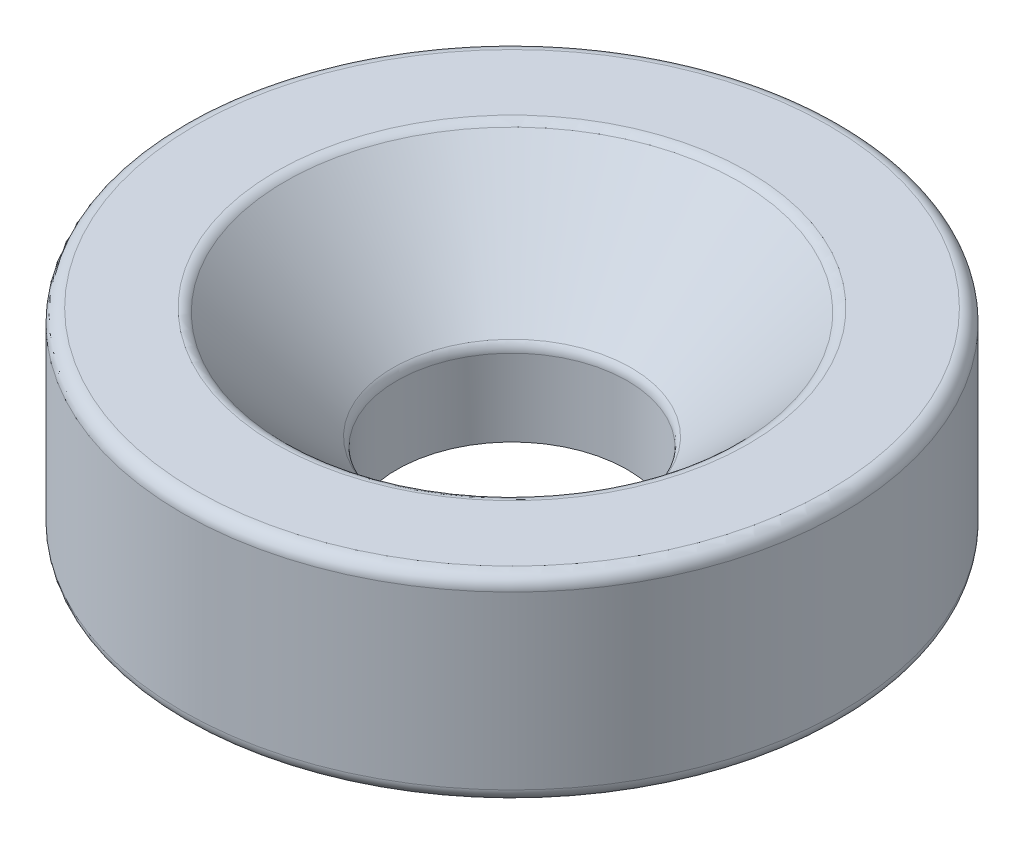
from build123d import *

# Parameters (mm, degrees)
SKETCH_1_R      = 5
SKETCH_1_R_2    = 1.75
EXTRUDE_1_DEPTH = 3
CHAMFER_1_SIZE  = 1.75
FILLET_1_R      = 0.2


with BuildPart() as part:
    # Эскиз1 → Бобышка-Вытянуть1 (new body)
    with BuildSketch(Plane(origin=(0, 0, 0), x_dir=(1, 0, 0), z_dir=(0, 1, 0))):
        Circle(SKETCH_1_R)
        Circle(SKETCH_1_R_2, mode=Mode.SUBTRACT)
    extrude(amount=EXTRUDE_1_DEPTH)

    # Фаска1
    chamfer_1_edges = [part.edges().sort_by_distance(p)[0] for p in [
        (-1.75, 3, 0),
    ]]
    chamfer(chamfer_1_edges, length=CHAMFER_1_SIZE)

    # Скругление1
    fillet_1_edges = [part.edges().sort_by_distance(p)[0] for p in [
        (-5, 0, 0),
        (-5, 3, 0),
        (-3.5, 3, 0),
        (-1.75, 1.25, 0),
    ]]
    fillet(fillet_1_edges, radius=FILLET_1_R)


solid = part.part
